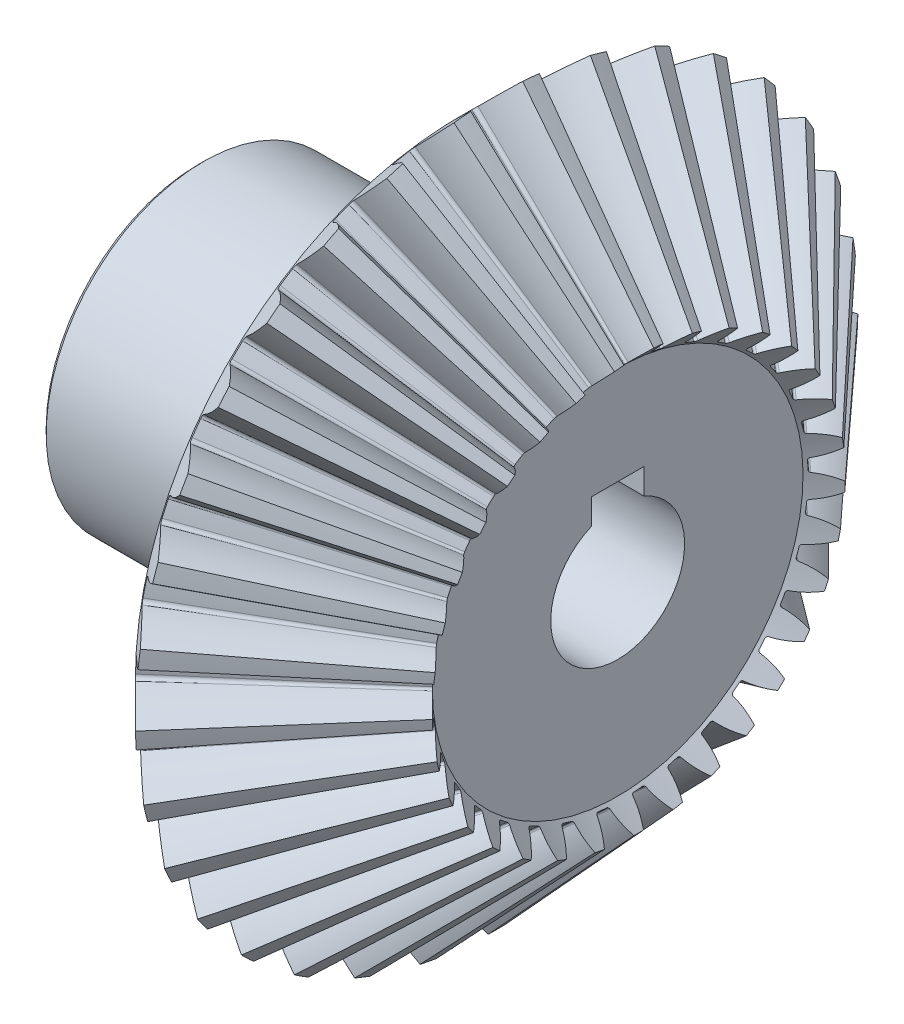
from build123d import *

# Parameters (mm, degrees)
TEETHCUTS_COUNT     = 33
TEETHCUTS_ANGLE     = 349.090909091
HUBSKE_R            = 15
HUB_DEPTH           = 24.899110576
BORSKE_R            = 6
BORE_DEPTH          = 60.0000508
KEYSKE_W            = 5
KEYSKE_H            = 8.3
KEYWAY_DEPTH        = 60.0000508
SKETCH_1_R          = 6.375
CUT_EXTRUDE_1_DEPTH = 63.954754894
CHAMFER_1_SIZE      = 0.5


with BuildPart() as part:
    # BasProSke → Base-Revolve (revolve)
    with BuildSketch(Plane(origin=(0, 0, 0), x_dir=(1, 0, 0), z_dir=(0, 1, 0)), mode=Mode.PRIVATE) as base_revolve_sk:
        Polygon((0, 0), (0, 30.899008978), (3.515204589, 34.414213561), (17.051279593, 19.666017319), (15.042514401, 17.65725213), (15.042514401, 0), align=None)
    revolve(base_revolve_sk.sketch.rotate(Axis((-10, 0, 0), (1, 0, 0)), 180), axis=Axis((-10, 0, 0), (1, 0, 0)))

    # ToothCut: read off the stored shape, not the designer's step
    # ToothCut: loft between two sections, ruled curve by curve
    toothcut_from = [
        Edge.make_bspline([(35.107690778, 0.006699753, -0.008456703), (35.103603519, 0.002612494, -0.014932926), (35.097471209, -0.003519816, -0.014555584), (35.093797147, -0.007193878, -0.007601782)], [0, 0, 0, 0, 1, 1, 1, 1], 3, [1, 0.755214674, 0.755214674, 1]),
        Edge.make_bspline([(35.093797147, -0.007193878, 0.007601782), (35.097471209, -0.003519816, 0.014555584), (35.103603519, 0.002612494, 0.014932926), (35.107690778, 0.006699753, 0.008456703)], [0, 0, 0, 0, 1, 1, 1, 1], 3, [1, 0.755214674, 0.755214674, 1]),
        Edge.make_bspline([(35.093797147, -0.007193878, -0.007601782), (35.093329664, -0.007661361, -0.006716989), (35.092947289, -0.008043736, -0.005753912), (35.092656483, -0.008334543, -0.004728825)], [0, 0, 0, 0, 1, 1, 1, 1], 3, [1, 0.994367202, 0.994367202, 1]),
        Edge.make_bspline([(35.092656483, -0.008334543, 0.004728825), (35.092947289, -0.008043736, 0.005753912), (35.093329664, -0.007661361, 0.006716989), (35.093797147, -0.007193878, 0.007601782)], [0, 0, 0, 0, 1, 1, 1, 1], 3, [1, 0.994367202, 0.994367202, 1]),
        Edge.make_bspline([(35.092656483, -0.008334543, -0.004728825), (35.091784654, -0.009206372, -0.001655643), (35.091784654, -0.009206372, 0.001655643), (35.092656483, -0.008334543, 0.004728825)], [0, 0, 0, 0, 1, 1, 1, 1], 3, [1, 0.952062005, 0.952062005, 1]),
        Edge.make_line((35.107690778, 0.006699753, 0.008456703), (35.107690778, 0.006699753, -0.008456703)),
    ]
    toothcut_to = [
        Edge.make_bspline([(3.929392843, 34.828401814, -2.853830934), (2.917314036, 33.816323009, -1.973517945), (1.80597253, 32.704981505, -1.379044987), (0.635283182, 31.534292159, -1.091763104)], [0, 0, 0, 0, 1, 1, 1, 1], 3, [1, 0.988028026, 0.988028026, 1]),
        Edge.make_bspline([(0.635283182, 31.534292159, 1.091763104), (1.80597253, 32.704981505, 1.379044987), (2.917314036, 33.816323009, 1.973517945), (3.929392843, 34.828401814, 2.853830934)], [0, 0, 0, 0, 1, 1, 1, 1], 3, [1, 0.988028026, 0.988028026, 1]),
        Edge.make_bspline([(0.635283182, 31.534292159, -1.091763104), (0.49897319, 31.397982167, -1.058313247), (0.411137284, 31.310146261, -0.907152976), (0.414351902, 31.313360879, -0.711553761)], [0, 0, 0, 0, 1, 1, 1, 1], 3, [1, 0.83842432, 0.83842432, 1]),
        Edge.make_bspline([(0.414351902, 31.313360879, 0.711553761), (0.411137284, 31.310146261, 0.907152976), (0.49897319, 31.397982167, 1.058313247), (0.635283182, 31.534292159, 1.091763104)], [0, 0, 0, 0, 1, 1, 1, 1], 3, [1, 0.83842432, 0.83842432, 1]),
        Edge.make_bspline([(0.414351902, 31.313360879, -0.711553761), (0.422147324, 31.321156301, -0.237227286), (0.422147324, 31.321156301, 0.237227286), (0.414351902, 31.313360879, 0.711553761)], [0, 0, 0, 0, 1, 1, 1, 1], 3, [1, 0.999820006, 0.999820006, 1]),
        Edge.make_line((3.929392843, 34.828401814, 2.853830934), (3.929392843, 34.828401814, -2.853830934)),
    ]
    toothcut = Solid(Shell([*[Face.make_surface_from_curves(toothcut_from[k], toothcut_to[k]) for k in range(6)], Face(Wire(toothcut_from)), Face(Wire(toothcut_to))]))
    add(toothcut, mode=Mode.SUBTRACT)

    # TeethCuts: ToothCut ×33 about axis
    teethcuts_axis = Axis((-10, 0, 0), (1, 0, 0))
    for i in range(1, TEETHCUTS_COUNT):
        add(toothcut.rotate(teethcuts_axis, i * TEETHCUTS_ANGLE / (TEETHCUTS_COUNT - 1)), mode=Mode.SUBTRACT)

    # HubSke → Hub (add)
    with BuildSketch(Plane.ZY):
        with Locations(Location((0, 0, 0), (0, 0, 180))):
            Circle(HUBSKE_R)
    extrude(amount=HUB_DEPTH)

    # BorSke → Bore (cut, symmetric)
    with BuildSketch(Plane(origin=(0, 0, 0), x_dir=(0, 0, -1), z_dir=(1, 0, 0))):
        with Locations(Location((0, 0, 0), (0, 0, 180))):
            Circle(BORSKE_R)
    extrude(amount=BORE_DEPTH, both=True, mode=Mode.SUBTRACT)

    # KeySke → Keyway (cut, symmetric)
    with BuildSketch(Plane(origin=(0, 0, 0), x_dir=(0, 0, -1), z_dir=(1, 0, 0))):
        with Locations((0, 4.15)):
            Rectangle(KEYSKE_W, KEYSKE_H)
    extrude(amount=KEYWAY_DEPTH, both=True, mode=Mode.SUBTRACT)

    # Эскиз1 → Вырез-Вытянуть1 (cut, through all)
    with BuildSketch(Plane(origin=(15.042514401, 0, 0), x_dir=(0, 0, -1), z_dir=(1, 0, 0))):
        Circle(SKETCH_1_R)
    extrude(amount=-CUT_EXTRUDE_1_DEPTH, mode=Mode.SUBTRACT)

    # Фаска1
    chamfer_1_edges = [part.edges().sort_by_distance(p)[0] for p in [
        (-24.899110576, 0, 15),
    ]]
    chamfer(chamfer_1_edges, length=CHAMFER_1_SIZE)


solid = part.part
